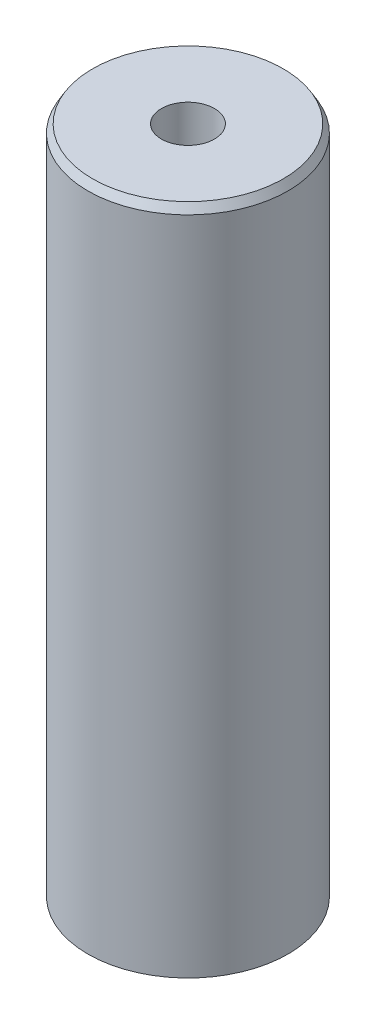
from build123d import *
from OCP.BRepFilletAPI import BRepFilletAPI_MakeChamfer

# Parameters (mm, degrees)
SKETCH1_R           = 12.5
BOSS_EXTRUDE1_DEPTH = 84.166438338
SKETCH2_R           = 3.312134864
CUT_EXTRUDE1_DEPTH  = 87.002844968
CHAMFER1_SIZE       = 1.017072105
CHAMFER1_SIZE2      = 0.587206854


with BuildPart() as part:
    # Sketch1 → Boss-Extrude1 (new body)
    with BuildSketch(Plane(origin=(0, 0, 0), x_dir=(1, 0, 0), z_dir=(0, 1, 0))):
        Circle(SKETCH1_R)
    extrude(amount=BOSS_EXTRUDE1_DEPTH)

    # Sketch2 → Cut-Extrude1 (cut, through all)
    with BuildSketch(Plane(origin=(0, 0, 0), x_dir=(1, 0, 0), z_dir=(0, 1, 0))):
        Circle(SKETCH2_R)
    extrude(amount=CUT_EXTRUDE1_DEPTH, mode=Mode.SUBTRACT)

    # Chamfer1: one chamfer whose edges measure the first distance from different faces: ONE call of the kernel's chamfer builder (chamfer() names one face for all edges)
    chamfer1_edges_1 = [part.edges().sort_by_distance(p)[0] for p in [
        (-12.5, 84.166438338, 0),
    ]]
    chamfer1_side_1 = [part.faces().sort_by_distance(p)[0] for p in [
        (-12.5, 42.083219169, 0),
    ]]
    chamfer1_edges_2 = [part.edges().sort_by_distance(p)[0] for p in [
        (-12.5, 0, 0),
    ]]
    chamfer1_side_2 = [part.faces().sort_by_distance(p)[0] for p in [
        (-12.146446609, 0, 0),
    ]]
    chamfer1 = BRepFilletAPI_MakeChamfer(part.part.solid().wrapped)
    for e in chamfer1_edges_1:
        chamfer1.Add(CHAMFER1_SIZE, CHAMFER1_SIZE2, e.wrapped, chamfer1_side_1[0].wrapped)  # the first distance lies on this face
    for e in chamfer1_edges_2:
        chamfer1.Add(CHAMFER1_SIZE, CHAMFER1_SIZE2, e.wrapped, chamfer1_side_2[0].wrapped)  # the first distance lies on this face
    add(Compound.cast(chamfer1.Shape()), mode=Mode.REPLACE)


solid = part.part
